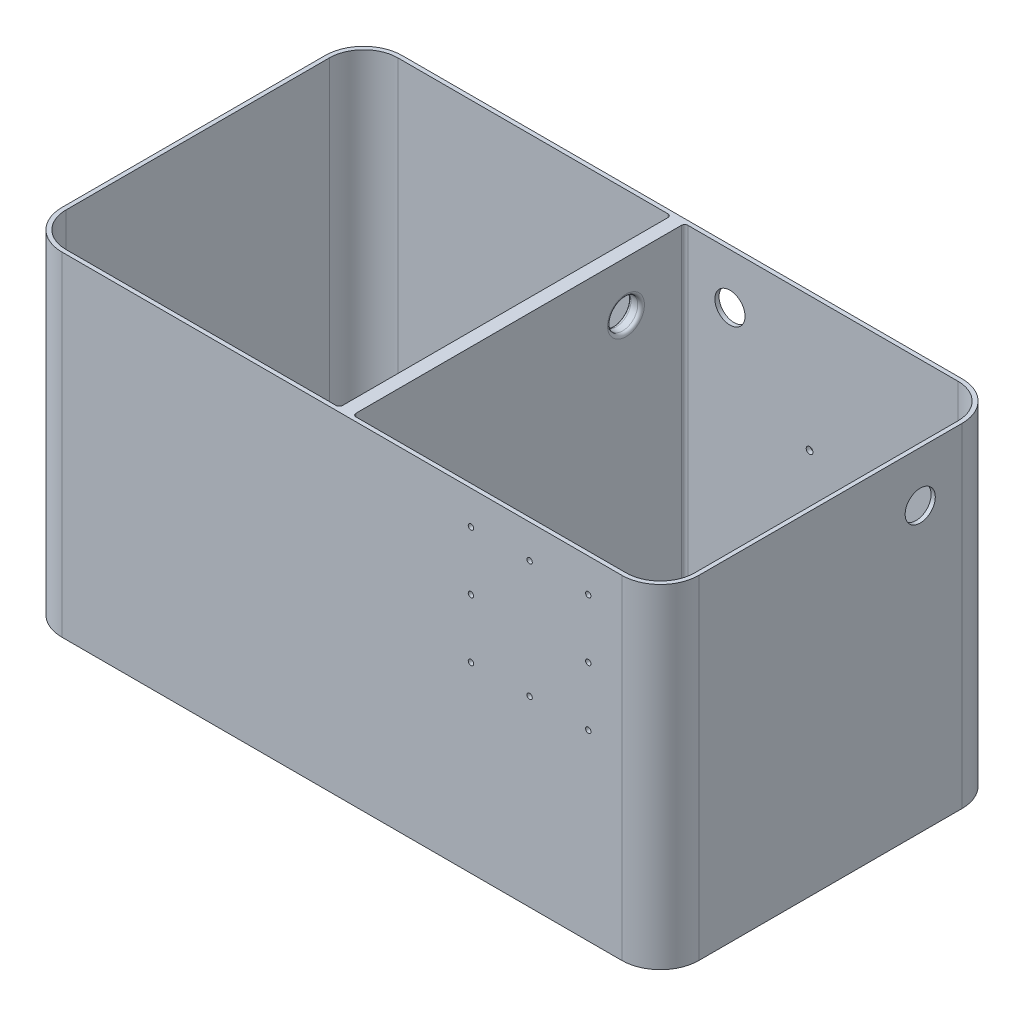
from build123d import *

# Parameters (mm, degrees)
EXTRUDE_1_DEPTH     = 199
CUT_EXTRUDE_1_DEPTH = 195
SKETCH_4_W          = 8
SKETCH_4_H          = 198
EXTRUDE_2_DEPTH     = 195
FILLET_1_R          = 2
CUT_EXTRUDE_2_REACH = 343.921
SKETCH_6_R          = 2
SKETCH_6_R_2        = 9
CUT_EXTRUDE_3_REACH = 297.87
SKETCH_7_R          = 9
FILLET_2_R          = 2
CUT_EXTRUDE_4_REACH = 442.798
SKETCH_9_R          = 9
CUT_EXTRUDE_5_REACH = 343.921
SKETCH_11_R         = 1.6
CUT_EXTRUDE_6_REACH = 343.921
SKETCH_12_R         = 1.6


with BuildPart() as part:
    # 草图1 → 凸台-拉伸1 (new body)
    with BuildSketch(Plane(origin=(0, 0, 0), x_dir=(1, 0, 0), z_dir=(0, 1, 0))):
        with BuildLine():
            Line((-167, 101.5), (167, 101.5))
            ThreePointArc((167, 101.5), (183.263455967, 94.763455967), (190, 78.5))
            Line((190, 78.5), (190, -78.5))
            ThreePointArc((190, -78.5), (183.263455967, -94.763455967), (167, -101.5))
            Line((167, -101.5), (-167, -101.5))
            ThreePointArc((-167, -101.5), (-183.263455967, -94.763455967), (-190, -78.5))
            Line((-190, -78.5), (-190, 78.5))
            ThreePointArc((-190, 78.5), (-183.263455967, 94.763455967), (-167, 101.5))
        make_face()
    extrude(amount=EXTRUDE_1_DEPTH)

    # 草图3 → 切除-拉伸1 (cut)
    with BuildSketch(Plane(origin=(0, 199, 0), x_dir=(1, 0, 0), z_dir=(0, 1, 0))):
        with BuildLine():
            Line((-167, 99), (167, 99))
            ThreePointArc((167, 99), (181.495689014, 92.995689014), (187.5, 78.5))
            Line((187.5, 78.5), (187.5, -78.5))
            ThreePointArc((187.5, -78.5), (181.495689014, -92.995689014), (167, -99))
            Line((167, -99), (-167, -99))
            ThreePointArc((-167, -99), (-181.495689014, -92.995689014), (-187.5, -78.5))
            Line((-187.5, -78.5), (-187.5, 78.5))
            ThreePointArc((-187.5, 78.5), (-181.495689014, 92.995689014), (-167, 99))
        make_face()
    extrude(amount=-CUT_EXTRUDE_1_DEPTH, mode=Mode.SUBTRACT)

    # 草图4 → 凸台-拉伸2 (add)
    with BuildSketch(Plane(origin=(0, 4, 0), x_dir=(1, 0, 0), z_dir=(0, 1, 0))):
        Rectangle(SKETCH_4_W, SKETCH_4_H)
    extrude(amount=EXTRUDE_2_DEPTH)

    # 圆角1
    fillet_1_edges = [part.edges().sort_by_distance(p)[0] for p in [
        (85.5, 4, 99),
        (181.495689014, 4, 92.995689014),
        (187.5, 4, 0),
        (181.495689014, 4, -92.995689014),
        (-85.5, 4, 99),
        (-181.495689014, 4, 92.995689014),
        (-187.5, 4, 0),
        (-181.495689014, 4, -92.995689014),
        (-4, 101.5, -99),
        (-4, 4, 0),
        (-4, 101.5, 99),
        (4, 101.5, 99),
        (4, 101.5, -99),
        (4, 4, 0),
        (85.5, 4, -99),
        (-85.5, 4, -99),
    ]]
    fillet(fillet_1_edges, radius=FILLET_1_R)

    # 草图6 → 切除-拉伸2 (cut, up to next)
    with BuildSketch(Plane(origin=(0, 0, -101.5), x_dir=(-1, 0, 0), z_dir=(0, 0, -1)), mode=Mode.PRIVATE) as cut_extrude_2_sk1:
        with Locations((-155, 119)):
            Circle(SKETCH_6_R)
    cut_extrude_2_tool1 = extrude(cut_extrude_2_sk1.sketch, amount=-CUT_EXTRUDE_2_REACH, mode=Mode.PRIVATE) & part.part
    # 草图6 → 切除-拉伸2 (cut, up to next)
    with BuildSketch(Plane(origin=(0, 0, -101.5), x_dir=(-1, 0, 0), z_dir=(0, 0, -1)), mode=Mode.PRIVATE) as cut_extrude_2_sk2:
        with Locations((-155, 64)):
            Circle(SKETCH_6_R)
    cut_extrude_2_tool2 = extrude(cut_extrude_2_sk2.sketch, amount=-CUT_EXTRUDE_2_REACH, mode=Mode.PRIVATE) & part.part
    # 草图6 → 切除-拉伸2 (cut, up to next)
    with BuildSketch(Plane(origin=(0, 0, -101.5), x_dir=(-1, 0, 0), z_dir=(0, 0, -1)), mode=Mode.PRIVATE) as cut_extrude_2_sk3:
        with Locations((-78.5, 64)):
            Circle(SKETCH_6_R)
    cut_extrude_2_tool3 = extrude(cut_extrude_2_sk3.sketch, amount=-CUT_EXTRUDE_2_REACH, mode=Mode.PRIVATE) & part.part
    # 草图6 → 切除-拉伸2 (cut, up to next)
    with BuildSketch(Plane(origin=(0, 0, -101.5), x_dir=(-1, 0, 0), z_dir=(0, 0, -1)), mode=Mode.PRIVATE) as cut_extrude_2_sk4:
        with Locations((-78.5, 119)):
            Circle(SKETCH_6_R)
    cut_extrude_2_tool4 = extrude(cut_extrude_2_sk4.sketch, amount=-CUT_EXTRUDE_2_REACH, mode=Mode.PRIVATE) & part.part
    # 草图6 → 切除-拉伸2 (cut, up to next)
    with BuildSketch(Plane(origin=(0, 0, -101.5), x_dir=(-1, 0, 0), z_dir=(0, 0, -1)), mode=Mode.PRIVATE) as cut_extrude_2_sk5:
        with Locations((-31, 169)):
            Circle(SKETCH_6_R_2)
    cut_extrude_2_tool5 = extrude(cut_extrude_2_sk5.sketch, amount=-CUT_EXTRUDE_2_REACH, mode=Mode.PRIVATE) & part.part
    add(cut_extrude_2_tool1.solids().sort_by_distance((155, 119, -101.5))[0], mode=Mode.SUBTRACT)
    add(cut_extrude_2_tool2.solids().sort_by_distance((155, 64, -101.5))[0], mode=Mode.SUBTRACT)
    add(cut_extrude_2_tool3.solids().sort_by_distance((78.5, 64, -101.5))[0], mode=Mode.SUBTRACT)
    add(cut_extrude_2_tool4.solids().sort_by_distance((78.5, 119, -101.5))[0], mode=Mode.SUBTRACT)
    add(cut_extrude_2_tool5.solids().sort_by_distance((31, 169, -101.5))[0], mode=Mode.SUBTRACT)

    # 草图7 → 切除-拉伸3 (cut, up to next)
    with BuildSketch(Plane(origin=(4, 0, 0), x_dir=(0, 0, -1), z_dir=(1, 0, 0)), mode=Mode.PRIVATE) as cut_extrude_3_sk1:
        with Locations((64, 169)):
            Circle(SKETCH_7_R)
    cut_extrude_3_tool1 = extrude(cut_extrude_3_sk1.sketch, amount=-CUT_EXTRUDE_3_REACH, mode=Mode.PRIVATE) & part.part
    add(cut_extrude_3_tool1.solids().sort_by_distance((4, 169, -64))[0], mode=Mode.SUBTRACT)

    # 圆角2
    fillet_2_edges = [part.edges().sort_by_distance(p)[0] for p in [
        (-4, 169, -55),
        (4, 169, -55),
    ]]
    fillet(fillet_2_edges, radius=FILLET_2_R)

    # 草图9 → 切除-拉伸4 (cut, up to next)
    with BuildSketch(Plane(origin=(190, 0, 0), x_dir=(0, 0, -1), z_dir=(1, 0, 0)), mode=Mode.PRIVATE) as cut_extrude_4_sk1:
        with Locations((53.5, 169)):
            Circle(SKETCH_9_R)
    cut_extrude_4_tool1 = extrude(cut_extrude_4_sk1.sketch, amount=-CUT_EXTRUDE_4_REACH, mode=Mode.PRIVATE) & part.part
    add(cut_extrude_4_tool1.solids().sort_by_distance((190, 169, -53.5))[0], mode=Mode.SUBTRACT)

    # 草图11 → 切除-拉伸5 (cut, up to next)
    with BuildSketch(Plane.XY.offset(101.5), mode=Mode.PRIVATE) as cut_extrude_5_sk1:
        with Locations((77, 179)):
            Circle(SKETCH_11_R)
    cut_extrude_5_tool1 = extrude(cut_extrude_5_sk1.sketch, amount=-CUT_EXTRUDE_5_REACH, mode=Mode.PRIVATE) & part.part
    # 草图11 → 切除-拉伸5 (cut, up to next)
    with BuildSketch(Plane.XY.offset(101.5), mode=Mode.PRIVATE) as cut_extrude_5_sk2:
        with Locations((147, 179)):
            Circle(SKETCH_11_R)
    cut_extrude_5_tool2 = extrude(cut_extrude_5_sk2.sketch, amount=-CUT_EXTRUDE_5_REACH, mode=Mode.PRIVATE) & part.part
    # 草图11 → 切除-拉伸5 (cut, up to next)
    with BuildSketch(Plane.XY.offset(101.5), mode=Mode.PRIVATE) as cut_extrude_5_sk3:
        with Locations((77, 109)):
            Circle(SKETCH_11_R)
    cut_extrude_5_tool3 = extrude(cut_extrude_5_sk3.sketch, amount=-CUT_EXTRUDE_5_REACH, mode=Mode.PRIVATE) & part.part
    # 草图11 → 切除-拉伸5 (cut, up to next)
    with BuildSketch(Plane.XY.offset(101.5), mode=Mode.PRIVATE) as cut_extrude_5_sk4:
        with Locations((147, 109)):
            Circle(SKETCH_11_R)
    cut_extrude_5_tool4 = extrude(cut_extrude_5_sk4.sketch, amount=-CUT_EXTRUDE_5_REACH, mode=Mode.PRIVATE) & part.part
    add(cut_extrude_5_tool1.solids().sort_by_distance((77, 179, 101.5))[0], mode=Mode.SUBTRACT)
    add(cut_extrude_5_tool2.solids().sort_by_distance((147, 179, 101.5))[0], mode=Mode.SUBTRACT)
    add(cut_extrude_5_tool3.solids().sort_by_distance((77, 109, 101.5))[0], mode=Mode.SUBTRACT)
    add(cut_extrude_5_tool4.solids().sort_by_distance((147, 109, 101.5))[0], mode=Mode.SUBTRACT)

    # 草图12 → 切除-拉伸6 (cut, up to next)
    with BuildSketch(Plane.XY.offset(101.5), mode=Mode.PRIVATE) as cut_extrude_6_sk1:
        with Locations((77, 144)):
            Circle(SKETCH_12_R)
    cut_extrude_6_tool1 = extrude(cut_extrude_6_sk1.sketch, amount=-CUT_EXTRUDE_6_REACH, mode=Mode.PRIVATE) & part.part
    # 草图12 → 切除-拉伸6 (cut, up to next)
    with BuildSketch(Plane.XY.offset(101.5), mode=Mode.PRIVATE) as cut_extrude_6_sk2:
        with Locations((112, 179)):
            Circle(SKETCH_12_R)
    cut_extrude_6_tool2 = extrude(cut_extrude_6_sk2.sketch, amount=-CUT_EXTRUDE_6_REACH, mode=Mode.PRIVATE) & part.part
    # 草图12 → 切除-拉伸6 (cut, up to next)
    with BuildSketch(Plane.XY.offset(101.5), mode=Mode.PRIVATE) as cut_extrude_6_sk3:
        with Locations((147, 144)):
            Circle(SKETCH_12_R)
    cut_extrude_6_tool3 = extrude(cut_extrude_6_sk3.sketch, amount=-CUT_EXTRUDE_6_REACH, mode=Mode.PRIVATE) & part.part
    # 草图12 → 切除-拉伸6 (cut, up to next)
    with BuildSketch(Plane.XY.offset(101.5), mode=Mode.PRIVATE) as cut_extrude_6_sk4:
        with Locations((112, 109)):
            Circle(SKETCH_12_R)
    cut_extrude_6_tool4 = extrude(cut_extrude_6_sk4.sketch, amount=-CUT_EXTRUDE_6_REACH, mode=Mode.PRIVATE) & part.part
    add(cut_extrude_6_tool1.solids().sort_by_distance((77, 144, 101.5))[0], mode=Mode.SUBTRACT)
    add(cut_extrude_6_tool2.solids().sort_by_distance((112, 179, 101.5))[0], mode=Mode.SUBTRACT)
    add(cut_extrude_6_tool3.solids().sort_by_distance((147, 144, 101.5))[0], mode=Mode.SUBTRACT)
    add(cut_extrude_6_tool4.solids().sort_by_distance((112, 109, 101.5))[0], mode=Mode.SUBTRACT)


solid = part.part
